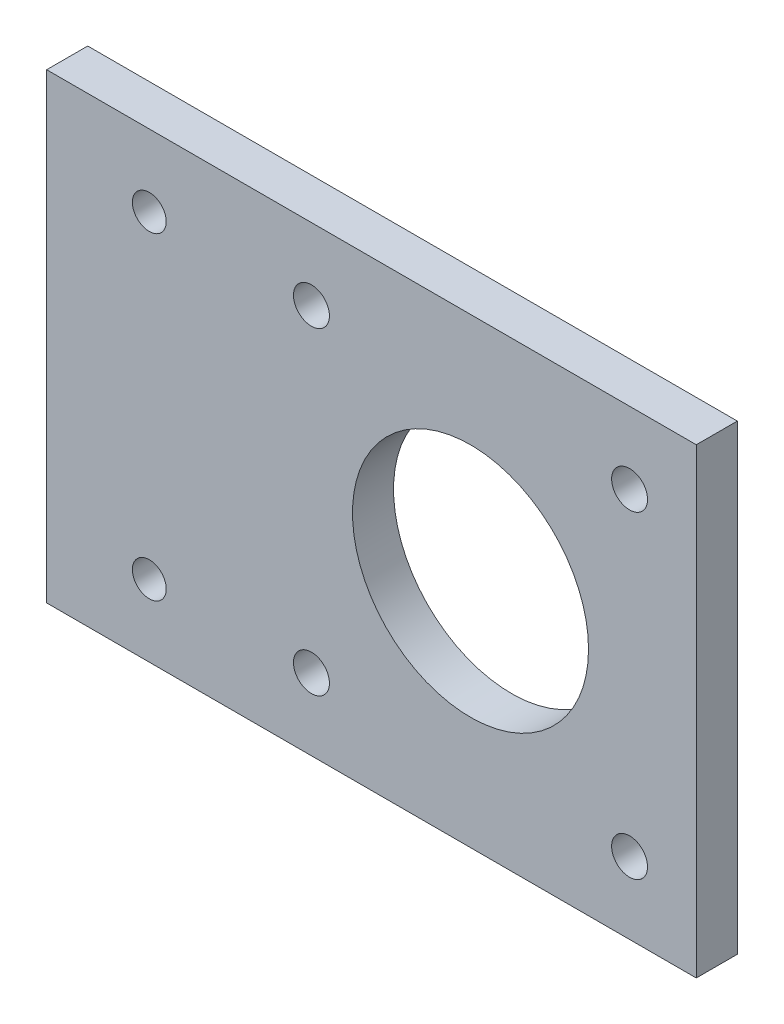
from build123d import *

# Parameters (mm, degrees)
ESBO_O1_W                  = 63.3
ESBO_O1_H                  = 45
ESBO_O1_R                  = 11.5
ESBO_O1_R_2                = 1.75
ESBO_O1_R_3                = 1.65
RESSALTO_EXTRUS_O1_DEPTH   = 25
CORTE_EXTRUS_O1_DEPTH      = 54.262932702
CORTE_EXTRUS_O1_DEPTH_BACK = 54.262932702
ESBO_O2_W                  = 63.3
ESBO_O2_H                  = 21


with BuildPart() as part:
    # Esboço1 → Ressalto-extrusão1 (new body)
    with BuildSketch(Plane.XY):
        with Locations((-9.65, 0)):
            Rectangle(ESBO_O1_W, ESBO_O1_H)
        Circle(ESBO_O1_R, mode=Mode.SUBTRACT)
        with Locations((-15.5, 15.5)):
            Circle(ESBO_O1_R_2, mode=Mode.SUBTRACT)
        with Locations((15.5, 15.5)):
            Circle(ESBO_O1_R_2, mode=Mode.SUBTRACT)
        with Locations((15.5, -15.5)):
            Circle(ESBO_O1_R_2, mode=Mode.SUBTRACT)
        with Locations((-15.5, -15.5)):
            Circle(ESBO_O1_R_2, mode=Mode.SUBTRACT)
        with Locations((-31.3, -15.5)):
            Circle(ESBO_O1_R_3, mode=Mode.SUBTRACT)
        with Locations((-31.3, 15.5)):
            Circle(ESBO_O1_R_3, mode=Mode.SUBTRACT)
    extrude(amount=RESSALTO_EXTRUS_O1_DEPTH)

    # Esboço2 → Corte-extrusão1 (cut, two sides: drawn at the far end of the back side and taken through both)
    with BuildSketch(Plane(origin=(0, 0, 0), x_dir=(1, 0, 0), z_dir=(0, 1, 0)).offset(-CORTE_EXTRUS_O1_DEPTH_BACK)):
        with Locations((-9.65, -14.5)):
            Rectangle(ESBO_O2_W, ESBO_O2_H)
    extrude(amount=CORTE_EXTRUS_O1_DEPTH + CORTE_EXTRUS_O1_DEPTH_BACK, mode=Mode.SUBTRACT)


solid = part.part
